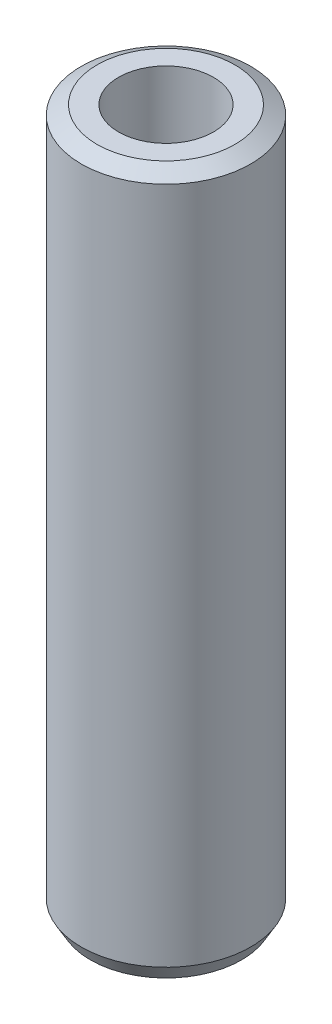
from build123d import *
from OCP.BRepFilletAPI import BRepFilletAPI_MakeChamfer

# Parameters (mm, degrees)
SKETCH1_R           = 15
BOSS_EXTRUDE1_DEPTH = 124.492116501
SKETCH2_R           = 8.403919129
CUT_EXTRUDE1_DEPTH  = 127.28652767
CHAMFER1_SIZE       = 1.608365304
CHAMFER1_SIZE2      = 2.785770423


with BuildPart() as part:
    # Sketch1 → Boss-Extrude1 (new body)
    with BuildSketch(Plane(origin=(0, 0, 0), x_dir=(1, 0, 0), z_dir=(0, 1, 0))):
        Circle(SKETCH1_R)
    extrude(amount=BOSS_EXTRUDE1_DEPTH)

    # Sketch2 → Cut-Extrude1 (cut, through all)
    with BuildSketch(Plane(origin=(0, 0, 0), x_dir=(1, 0, 0), z_dir=(0, 1, 0))):
        Circle(SKETCH2_R)
    extrude(amount=CUT_EXTRUDE1_DEPTH, mode=Mode.SUBTRACT)

    # Chamfer1: one chamfer whose edges measure the first distance from different faces: ONE call of the kernel's chamfer builder (chamfer() names one face for all edges)
    chamfer1_edges_1 = [part.edges().sort_by_distance(p)[0] for p in [
        (-15, 124.492116501, 0),
    ]]
    chamfer1_side_1 = [part.faces().sort_by_distance(p)[0] for p in [
        (-15, 62.24605825, 0),
    ]]
    chamfer1_edges_2 = [part.edges().sort_by_distance(p)[0] for p in [
        (-15, 0, 0),
    ]]
    chamfer1_side_2 = [part.faces().sort_by_distance(p)[0] for p in [
        (-14.575735931, 0, 0),
    ]]
    chamfer1 = BRepFilletAPI_MakeChamfer(part.part.solid().wrapped)
    for e in chamfer1_edges_1:
        chamfer1.Add(CHAMFER1_SIZE, CHAMFER1_SIZE2, e.wrapped, chamfer1_side_1[0].wrapped)  # the first distance lies on this face
    for e in chamfer1_edges_2:
        chamfer1.Add(CHAMFER1_SIZE, CHAMFER1_SIZE2, e.wrapped, chamfer1_side_2[0].wrapped)  # the first distance lies on this face
    add(Compound.cast(chamfer1.Shape()), mode=Mode.REPLACE)


solid = part.part
